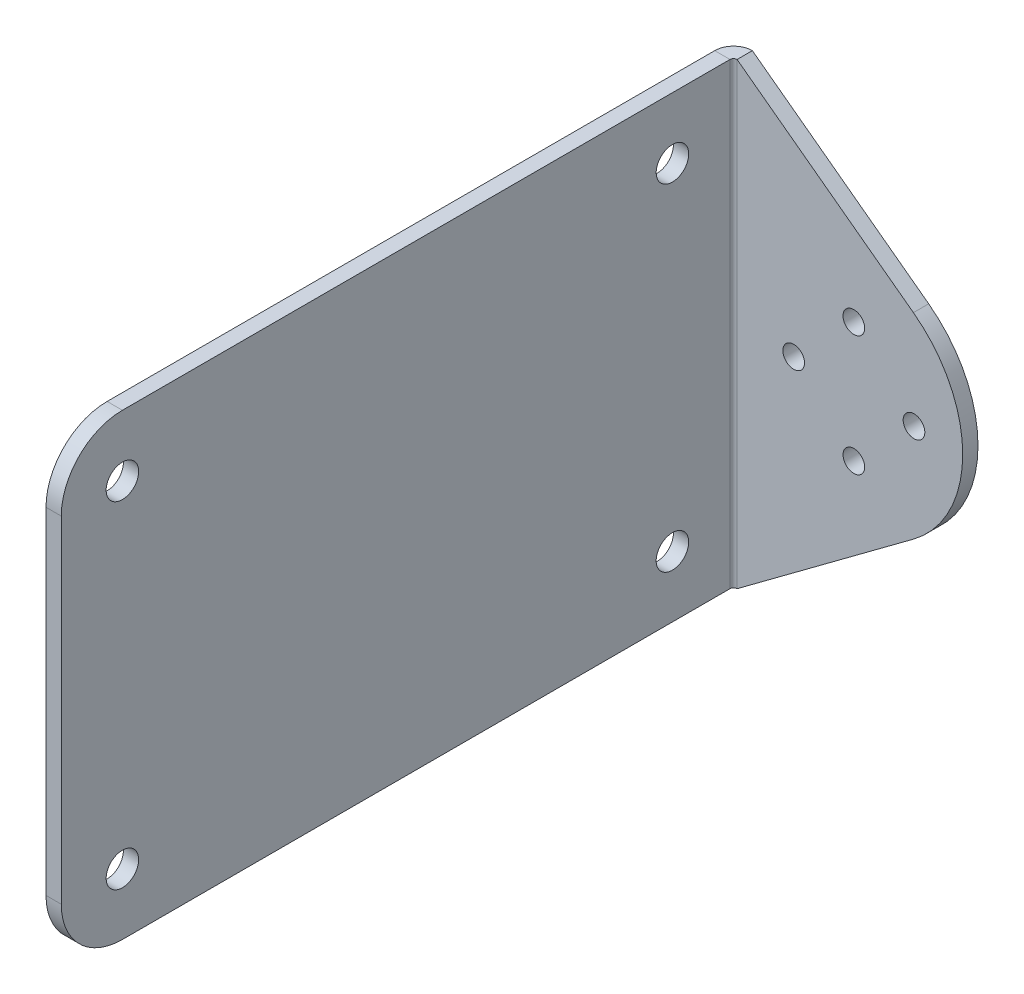
from build123d import *

# Parameters (mm, degrees)
SKETCH3_W                    = 139.7
SKETCH3_H                    = 95.25
BASE_FLANGE1_DEPTH           = 3.175
EDGE_FLANGE1_STRIP_W         = 14.1732
EDGE_FLANGE1_STRIP_H         = 3.175
EDGE_FLANGE1_STRIP_CUT_DEPTH = 95.25
EDGE_FLANGE1_DEPTH           = 95.25
CUT_EXTRUDE2_START           = -3.175
CUT_EXTRUDE2_DEPTH           = 3.175
F_8_CLEARANCE_HOLE1_D        = 4.4958
F_1_4_CLEARANCE_HOLE1_D      = 6.7564
FILLET1_R                    = 12.7


# Read off the part's stored shape, not the designer's step: Cut-Extrude2
# Sheet-metal steps are written as plain solids
with BuildPart() as part:
    # Sketch3 → Base-Flange1 (new body)
    with BuildSketch(Plane(origin=(0, 0, 0), x_dir=(0, 0, -1), z_dir=(1, 0, 0))):
        Rectangle(SKETCH3_W, SKETCH3_H)
    extrude(amount=-BASE_FLANGE1_DEPTH)

    # Edge-Flange1 strip (across the edge) → Edge-Flange1 strip cut (cut)
    with BuildSketch(Plane(origin=(0, -47.625, -69.85), x_dir=(0, 0, 1), z_dir=(0, 1, 0))):
        with Locations((-6.35, -1.5875)):
            Rectangle(EDGE_FLANGE1_STRIP_W, EDGE_FLANGE1_STRIP_H)
    extrude(amount=EDGE_FLANGE1_STRIP_CUT_DEPTH, mode=Mode.SUBTRACT)

    # Edge-Flange1 section (across the edge) → Edge-Flange1 (add)
    with BuildSketch(Plane(origin=(0, -47.625, -69.85), x_dir=(0, 0, 1), z_dir=(0, 1, 0))):
        with BuildLine():
            Line((-3.175, 0.7366), (-3.175, 47.625))
            Line((-3.175, 47.625), (0, 47.625))
            Line((0, 47.625), (0, 0.7366))
            ThreePointArc((0, 0.7366), (0.215745145, 0.215745145), (0.7366, 0))
            Line((0.7366, 0), (0.7366, -3.175))
            ThreePointArc((0.7366, -3.175), (-2.029318885, -2.029318885), (-3.175, 0.7366))
        make_face()
    extrude(amount=EDGE_FLANGE1_DEPTH)

    # Cut-Extrude2 outline → Cut-Extrude2 (cut)
    with BuildSketch(Plane(origin=(0, 0, -73.025), x_dir=(-1, 0, 0), z_dir=(0, 0, -1)).offset(CUT_EXTRUDE2_START)):
        with BuildLine():
            ThreePointArc((-37.379054473, -20.384176045), (-44.919415432, -11.407169158), (-47.625, 0))
            Line((-47.625, 0), (-47.625, -47.625))
            Line((-47.625, -47.625), (-0.7366, -47.625))
            Line((-0.7366, -47.625), (-37.379054473, -20.384176045))
        make_face()
        with BuildLine():
            ThreePointArc((-47.625, 0), (-44.919415432, 11.407169158), (-37.379054473, 20.384176045))
            Line((-37.379054473, 20.384176045), (-0.7366, 47.625))
            Line((-0.7366, 47.625), (-47.625, 47.625))
            Line((-47.625, 47.625), (-47.625, 0))
        make_face()
    extrude(amount=CUT_EXTRUDE2_DEPTH, mode=Mode.SUBTRACT)

    # #8 Clearance Hole1 (through all)
    with Locations(Plane(origin=(0, 0, -73.025), x_dir=(-1, 0, 0), z_dir=(0, 0, -1))):
        with Locations((-25, -12.5), (-37.5, 0), (-25, 12.5), (-12.5, 0)):
            Hole(F_8_CLEARANCE_HOLE1_D / 2)

    # 1/4 Clearance Hole1 (through all)
    with Locations(Plane(origin=(0, 0, 0), x_dir=(0, 0, -1), z_dir=(1, 0, 0))):
        with Locations((-57.15, 34.925), (57.15, 34.925), (57.15, -34.925), (-57.15, -34.925)):
            Hole(F_1_4_CLEARANCE_HOLE1_D / 2)

    # Fillet1
    fillet1_edges = [part.edges().sort_by_distance(p)[0] for p in [
        (-1.5875, -47.625, 69.85),
        (-1.5875, 47.625, 69.85),
    ]]
    fillet(fillet1_edges, radius=FILLET1_R)


solid = part.part
